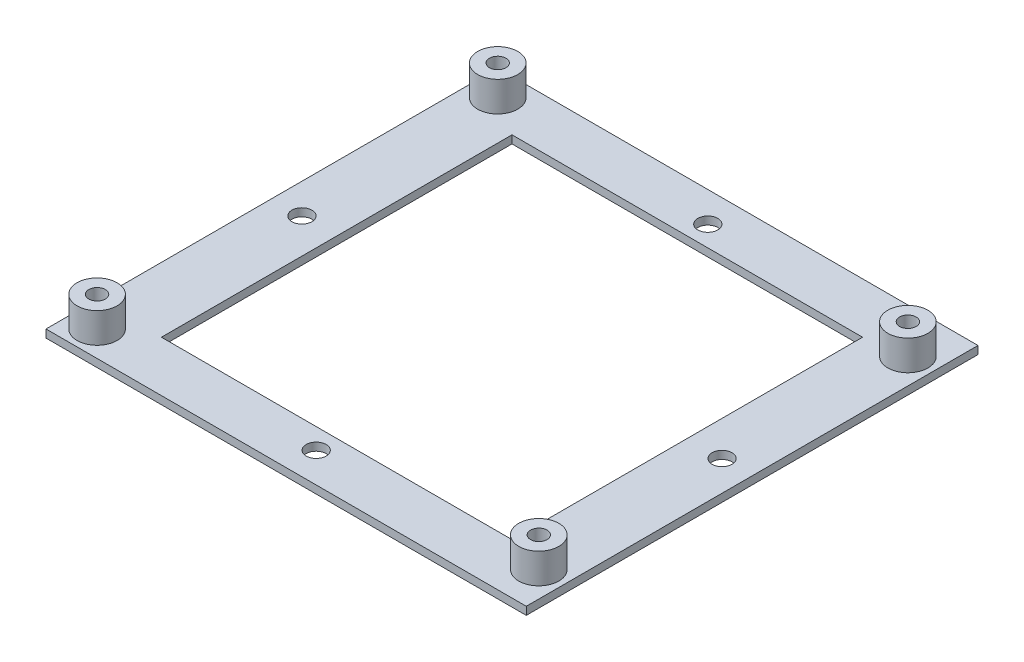
from build123d import *

# Parameters (mm, degrees)
SKETCH1_W                 = 95.9
SKETCH1_H                 = 90.2
BOSS_EXTRUDE1_DEPTH       = 1.58
SKETCH2_R                 = 4
BOSS_EXTRUDE2_DEPTH       = 6
M4X0_7_TAPPED_HOLE1_D     = 3.3
M4X0_7_TAPPED_HOLE1_DEPTH = 6
M4X0_7_TAPPED_HOLE1_TIP   = 0.991420021
CUT_EXTRUDE1_DEPTH        = 67.100018911
CUT_EXTRUDE1_DEPTH_BACK   = 67.100018911
SKETCH4_R                 = 2
SKETCH4_W                 = 70
SKETCH4_H                 = 70


with BuildPart() as part:
    # Sketch1 → Boss-Extrude1 (new body)
    with BuildSketch(Plane(origin=(0, 0, 0), x_dir=(1, 0, 0), z_dir=(0, 1, 0))):
        Rectangle(SKETCH1_W, SKETCH1_H)
    extrude(amount=BOSS_EXTRUDE1_DEPTH)

    # Sketch2 → Boss-Extrude2 (add)
    with BuildSketch(Plane(origin=(0, 1.58, 0), x_dir=(1, 0, 0), z_dir=(0, 1, 0))):
        with Locations((42.85, 36.2)):
            Circle(SKETCH2_R)
        with Locations((42.85, -37.5)):
            Circle(SKETCH2_R)
        with Locations((-42.85, -40)):
            Circle(SKETCH2_R)
        with Locations((-42.85, 40)):
            Circle(SKETCH2_R)
    extrude(amount=BOSS_EXTRUDE2_DEPTH)

    # M4x0.7 Tapped Hole1
    with Locations(Plane(origin=(-42.85, 7.58, -40), x_dir=(0, 0, 1), z_dir=(0, 1, 0))):
        with Locations((0, 0), (80, 0), (77.5, 85.7), (3.8, 85.7)):
            Hole(M4X0_7_TAPPED_HOLE1_D / 2, depth=M4X0_7_TAPPED_HOLE1_DEPTH)
            with Locations((0, 0, -(M4X0_7_TAPPED_HOLE1_DEPTH + M4X0_7_TAPPED_HOLE1_TIP / 2))):  # 118° drill point
                Cone(0, M4X0_7_TAPPED_HOLE1_D / 2, M4X0_7_TAPPED_HOLE1_TIP, mode=Mode.SUBTRACT)

    # Sketch4 → Cut-Extrude1 (cut, two sides: drawn at the far end of the back side and taken through both)
    with BuildSketch(Plane(origin=(0, 1.58, 0), x_dir=(1, 0, 0), z_dir=(0, 1, 0)).offset(-CUT_EXTRUDE1_DEPTH_BACK)):
        with Locations((0, 39.1)):
            Circle(SKETCH4_R)
        with Locations((41.95, 0)):
            Circle(SKETCH4_R)
        with Locations((0, -39.1)):
            Circle(SKETCH4_R)
        with Locations((-41.95, 0)):
            Circle(SKETCH4_R)
        Rectangle(SKETCH4_W, SKETCH4_H)
    extrude(amount=CUT_EXTRUDE1_DEPTH + CUT_EXTRUDE1_DEPTH_BACK, mode=Mode.SUBTRACT)


solid = part.part
